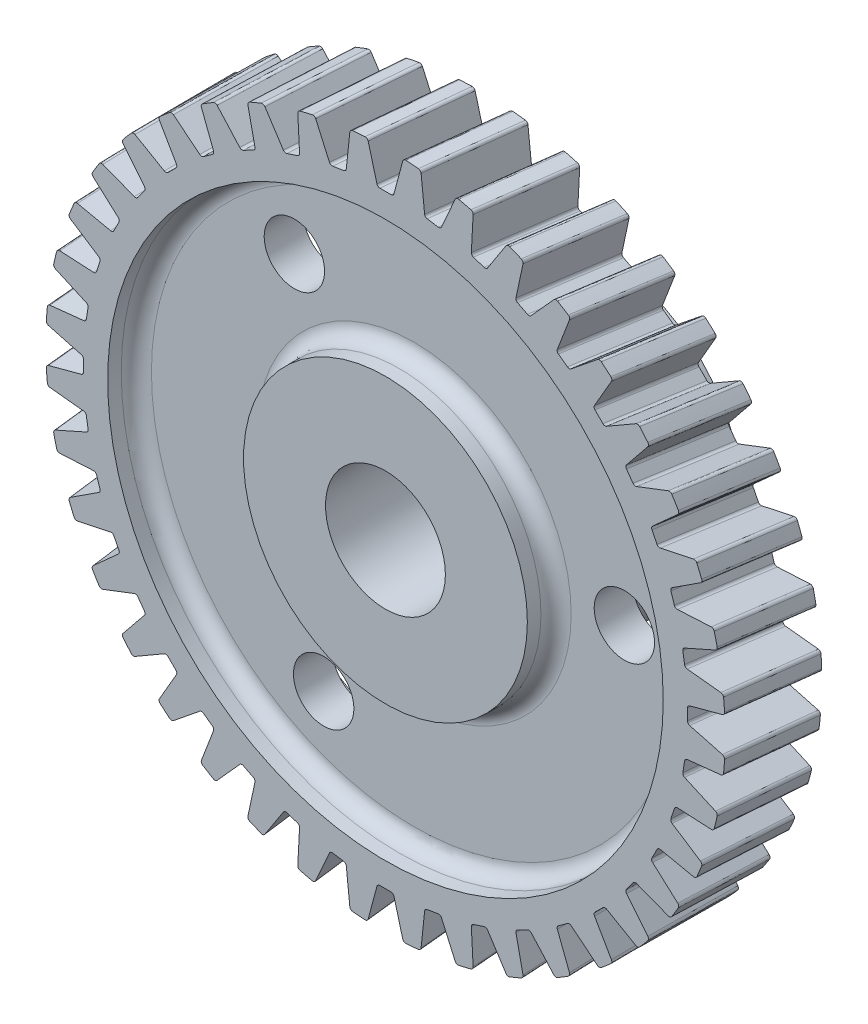
from build123d import *

# Parameters (mm, degrees)
FILLET1_R                = 1
CIRPATTERN1_COUNT        = 40
FILLET2_R                = 0.2
F_4_0_4_DIAMETER_HOLE1_D = 4


with BuildPart() as part:
    # Sketch2 → Revolve1 (revolve)
    with BuildSketch(Plane(origin=(0, 0, 0), x_dir=(0, 0, -1), z_dir=(1, 0, 0))):
        Polygon((11, 3.96875), (-3.2, 3.96875), (-3.2, 9.4), (-1.3, 9.4), (-1.3, 18.4), (-3.2, 18.4), (-3.2, 22.5), (3.2, 22.5), (3.2, 18.4), (1.3, 18.4), (1.3, 9.4), (3.2, 9.4), (11, 9.4), align=None)
    revolve(axis=Axis((0, 0, 0), (0, 0, -1)))

    # Fillet1
    fillet1_edges = [part.edges().sort_by_distance(p)[0] for p in [
        (0, -18.4, 1.3),
        (0, -9.4, 1.3),
        (0, -9.4, -1.3),
        (0, -18.4, -1.3),
    ]]
    fillet(fillet1_edges, radius=FILLET1_R)

    # Cut-Sweep1: sweep along a path in Sketch4
    with BuildLine(Plane(origin=(0, 0, 0), x_dir=(1, 0, 0), z_dir=(0, 1, 0))) as cut_sweep1_path:
        Line((0, -3.2), (0.690971205, 3.2))
    # Sketch3 → Cut-Sweep1 (sweep, cut)
    with BuildSketch(Plane.XY.offset(3.2)):
        Polygon((-0.525, 20), (0.525, 20), (1.246362285, 22.6921607), (-1.246362285, 22.6921607), align=None)
    cut_sweep1 = sweep(path=cut_sweep1_path.line, mode=Mode.SUBTRACT)

    # CirPattern1: Cut-Sweep1 ×40 about axis
    cirpattern1_axis = Axis((0, 0, 3.2), (0, 0, 1))
    for i in range(1, CIRPATTERN1_COUNT):
        add(cut_sweep1.rotate(cirpattern1_axis, i * 360 / CIRPATTERN1_COUNT), mode=Mode.SUBTRACT)

    # Fillet2
    fillet2_edges = [part.edges().sort_by_distance(p)[0] for p in [
        (1.526462518, 22.448160552, 5.3054e-05),
        (0.870485603, 20, 0),
        (-0.845126217, 22.484122435, -6.2808e-05),
        (-2.003996756, 22.410577793, 5.3054e-05),
        (-2.26892082, 19.889940761, 0),
        (-3.305993578, 19.725684573, 0),
        (-4.352012976, 22.07509871, -6.2808e-05),
        (-5.485110979, 21.821172231, 5.3054e-05),
        (-5.352458883, 19.29012517, 0),
        (-6.351068225, 18.965657326, 0),
        (-7.751738732, 21.122512792, -6.2808e-05),
        (-8.831163565, 20.694456989, 5.3054e-05),
        (-8.304201644, 18.215322678, 0),
        (-9.239758494, 17.738632653, 0),
        (-10.960590953, 19.649820507, -6.2808e-05),
        (-11.959763596, 19.058175535, 5.3054e-05),
        (-11.0514674, 16.691998487, 0),
        (-11.900935244, 16.074823972, 0),
        (-13.89955705, 17.693284427, -6.2808e-05),
        (-14.793874554, 16.952618549, 5.3054e-05),
        (-13.526609351, 14.757661896, 0),
        (-14.269071471, 14.015199776, 0),
        (-16.496269922, 15.301080964, -6.2808e-05),
        (-17.263711223, 14.429631832, 5.3054e-05),
        (-15.668681288, 12.459942692, 0),
        (-16.285855803, 11.610474848, 0),
        (-18.68678988, 12.532114106, -6.2808e-05),
        (-19.308458027, 11.55133969, 5.3054e-05),
        (-17.42493829, 9.855418346, 0),
        (-17.901628315, 8.919861496, 0),
        (-20.417179054, 9.454565008, -6.2808e-05),
        (-20.877766513, 8.388615227, 5.3054e-05),
        (-18.752135481, 7.008220892, 0),
        (-19.076603325, 6.00961155, 0),
        (-21.644829518, 6.144213141, -6.2808e-05),
        (-21.932995098, 5.019335218, 5.3054e-05),
        (-19.617592862, 3.988457781, 0),
        (-19.781849051, 2.951385024, 0),
        (-22.339512445, 2.682570354, -6.2808e-05),
        (-22.448160552, 1.526462518, 5.3054e-05),
        (-20, 0.870485603, 0),
        (-20, -0.179514397, 0),
        (-22.484122435, -0.845126217, -6.2808e-05),
        (-22.410577793, -2.003996756, 5.3054e-05),
        (-19.889940761, -2.26892082, 0),
        (-19.725684573, -3.305993578, 0),
        (-22.07509871, -4.352012976, -6.2808e-05),
        (-21.821172231, -5.485110979, 5.3054e-05),
        (-19.29012517, -5.352458883, 0),
        (-18.965657326, -6.351068225, 0),
        (-21.122512792, -7.751738732, -6.2808e-05),
        (-20.694456989, -8.831163565, 5.3054e-05),
        (-18.215322678, -8.304201644, 0),
        (-17.738632653, -9.239758494, 0),
        (-19.649820507, -10.960590953, -6.2808e-05),
        (-19.058175535, -11.959763596, 5.3054e-05),
        (-16.691998487, -11.0514674, 0),
        (-16.074823972, -11.900935244, 0),
        (-17.693284427, -13.89955705, -6.2808e-05),
        (-16.952618549, -14.793874554, 5.3054e-05),
        (-14.757661896, -13.526609351, 0),
        (-14.015199776, -14.269071471, 0),
        (-15.301080964, -16.496269922, -6.2808e-05),
        (-14.429631832, -17.263711223, 5.3054e-05),
        (-12.459942692, -15.668681288, 0),
        (-11.610474848, -16.285855803, 0),
        (-12.532114106, -18.68678988, -6.2808e-05),
        (-11.55133969, -19.308458027, 5.3054e-05),
        (-9.855418346, -17.42493829, 0),
        (-8.919861496, -17.901628315, 0),
        (-9.454565008, -20.417179054, -6.2808e-05),
        (-8.388615227, -20.877766513, 5.3054e-05),
        (-7.008220892, -18.752135481, 0),
        (-6.00961155, -19.076603325, 0),
        (-6.144213141, -21.644829518, -6.2808e-05),
        (-5.019335218, -21.932995098, 5.3054e-05),
        (-3.988457781, -19.617592862, 0),
        (-2.951385024, -19.781849051, 0),
        (-2.682570354, -22.339512445, -6.2808e-05),
        (-1.526462518, -22.448160552, 5.3054e-05),
        (-0.870485603, -20, 0),
        (0.179514397, -20, 0),
        (0.845126217, -22.484122435, -6.2808e-05),
        (2.003996756, -22.410577793, 5.3054e-05),
        (2.26892082, -19.889940761, 0),
        (3.305993578, -19.725684573, 0),
        (4.352012976, -22.07509871, -6.2808e-05),
        (5.485110979, -21.821172231, 5.3054e-05),
        (5.352458883, -19.29012517, 0),
        (6.351068225, -18.965657326, 0),
        (7.751738732, -21.122512792, -6.2808e-05),
        (8.831163565, -20.694456989, 5.3054e-05),
        (8.304201644, -18.215322678, 0),
        (9.239758494, -17.738632653, 0),
        (10.960590953, -19.649820507, -6.2808e-05),
        (11.959763596, -19.058175535, 5.3054e-05),
        (11.0514674, -16.691998487, 0),
        (11.900935244, -16.074823972, 0),
        (13.89955705, -17.693284427, -6.2808e-05),
        (14.793874554, -16.952618549, 5.3054e-05),
        (13.526609351, -14.757661896, 0),
        (14.269071471, -14.015199776, 0),
        (16.496269922, -15.301080964, -6.2808e-05),
        (17.263711223, -14.429631832, 5.3054e-05),
        (15.668681288, -12.459942692, 0),
        (16.285855803, -11.610474848, 0),
        (18.68678988, -12.532114106, -6.2808e-05),
        (19.308458027, -11.55133969, 5.3054e-05),
        (17.42493829, -9.855418346, 0),
        (17.901628315, -8.919861496, 0),
        (20.417179054, -9.454565008, -6.2808e-05),
        (20.877766513, -8.388615227, 5.3054e-05),
        (18.752135481, -7.008220892, 0),
        (19.076603325, -6.00961155, 0),
        (21.644829518, -6.144213141, -6.2808e-05),
        (21.932995098, -5.019335218, 5.3054e-05),
        (19.617592862, -3.988457781, 0),
        (19.781849051, -2.951385024, 0),
        (22.339512445, -2.682570354, -6.2808e-05),
        (22.448160552, -1.526462518, 5.3054e-05),
        (20, -0.870485603, 0),
        (20, 0.179514397, 0),
        (22.484122435, 0.845126217, -6.2808e-05),
        (22.410577793, 2.003996756, 5.3054e-05),
        (19.889940761, 2.26892082, 0),
        (19.725684573, 3.305993578, 0),
        (22.07509871, 4.352012976, -6.2808e-05),
        (21.821172231, 5.485110979, 5.3054e-05),
        (19.29012517, 5.352458883, 0),
        (18.965657326, 6.351068225, 0),
        (21.122512792, 7.751738732, -6.2808e-05),
        (20.694456989, 8.831163565, 5.3054e-05),
        (18.215322678, 8.304201644, 0),
        (17.738632653, 9.239758494, 0),
        (19.649820507, 10.960590953, -6.2808e-05),
        (19.058175535, 11.959763596, 5.3054e-05),
        (16.691998487, 11.0514674, 0),
        (16.074823972, 11.900935244, 0),
        (17.693284427, 13.89955705, -6.2808e-05),
        (16.952618549, 14.793874554, 5.3054e-05),
        (14.757661896, 13.526609351, 0),
        (14.015199776, 14.269071471, 0),
        (15.301080964, 16.496269922, -6.2808e-05),
        (14.429631832, 17.263711223, 5.3054e-05),
        (12.459942692, 15.668681288, 0),
        (11.610474848, 16.285855803, 0),
        (12.532114106, 18.68678988, -6.2808e-05),
        (11.55133969, 19.308458027, 5.3054e-05),
        (9.855418346, 17.42493829, 0),
        (8.919861496, 17.901628315, 0),
        (9.454565008, 20.417179054, -6.2808e-05),
        (8.388615227, 20.877766513, 5.3054e-05),
        (7.008220892, 18.752135481, 0),
        (6.00961155, 19.076603325, 0),
        (6.144213141, 21.644829518, -6.2808e-05),
        (5.019335218, 21.932995098, 5.3054e-05),
        (3.988457781, 19.617592862, 0),
        (2.951385024, 19.781849051, 0),
        (2.682570354, 22.339512445, -6.2808e-05),
        (-0.179514397, 20, 0),
    ]]
    fillet(fillet2_edges, radius=FILLET2_R)

    # Ø4.0 (4) Diameter Hole1 (through all)
    with Locations(Plane(origin=(59.759048418, -178.20301315, 3.9366), x_dir=(0.9999854958897523, -0.005385908477352911, 0), z_dir=(0, 0, 1))):
        with Locations((-66.641435269, 165.227939405), (-68.712001493, 189.333762045), (-46.800463595, 179.074013676)):
            Hole(F_4_0_4_DIAMETER_HOLE1_D / 2)


solid = part.part
